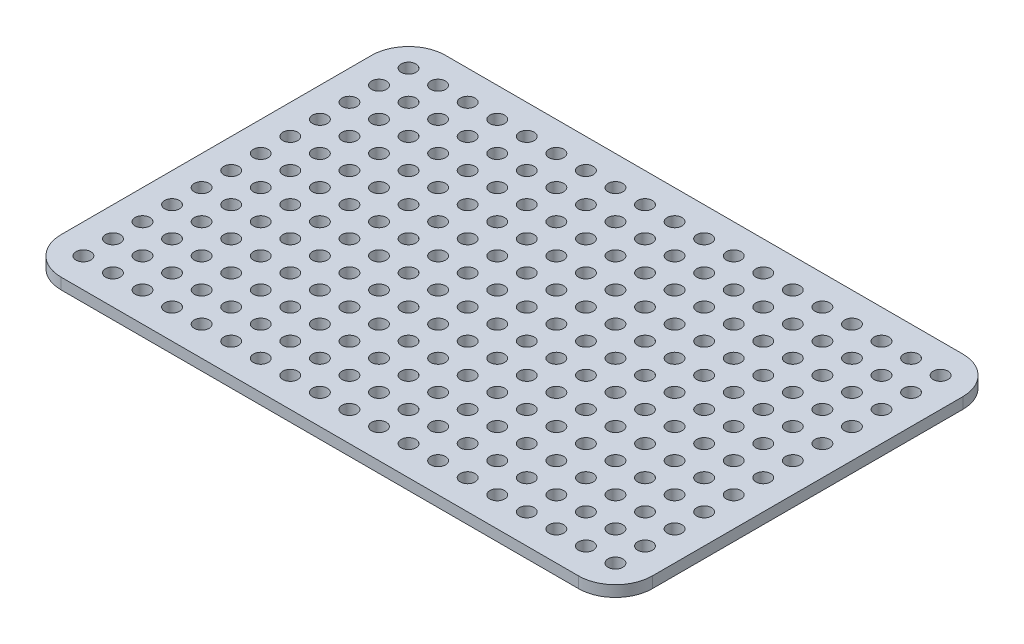
from build123d import *

# Parameters (mm, degrees)
SKETCH1_W            = 160
SKETCH1_H            = 104
BOSS_EXTRUDE1_DEPTH  = 3
FILLET1_R            = 10
SKETCH2_R            = 2
CUT_EXTRUDE1_DEPTH   = 3
LPATTERN1_COUNT      = 19
LPATTERN1_PITCH      = 8
LPATTERN1_COUNT_DIR2 = 12
LPATTERN1_PITCH_DIR2 = 8


with BuildPart() as part:
    # Sketch1 → Boss-Extrude1 (new body)
    with BuildSketch(Plane(origin=(0, 0, 0), x_dir=(1, 0, 0), z_dir=(0, 1, 0))):
        with Locations((80, 52)):
            Rectangle(SKETCH1_W, SKETCH1_H)
    extrude(amount=BOSS_EXTRUDE1_DEPTH)

    # Fillet1
    fillet1_edges = [part.edges().sort_by_distance(p)[0] for p in [
        (160, 1.5, 0),
        (160, 1.5, -104),
        (0, 1.5, 0),
        (0, 1.5, -104),
    ]]
    fillet(fillet1_edges, radius=FILLET1_R)

    # Sketch2 → Cut-Extrude1 (cut)
    with BuildSketch(Plane(origin=(0, 3, 0), x_dir=(1, 0, 0), z_dir=(0, 1, 0))):
        with Locations((8, 96)):
            Circle(SKETCH2_R)
    cut_extrude1 = extrude(amount=-CUT_EXTRUDE1_DEPTH, mode=Mode.SUBTRACT)

    # LPattern1: Cut-Extrude1 19 × 12
    with Locations(*[(i * LPATTERN1_PITCH, 0, j * LPATTERN1_PITCH_DIR2) for i in range(LPATTERN1_COUNT) for j in range(LPATTERN1_COUNT_DIR2) if (i, j) != (0, 0)]):
        add(cut_extrude1, mode=Mode.SUBTRACT)


solid = part.part
